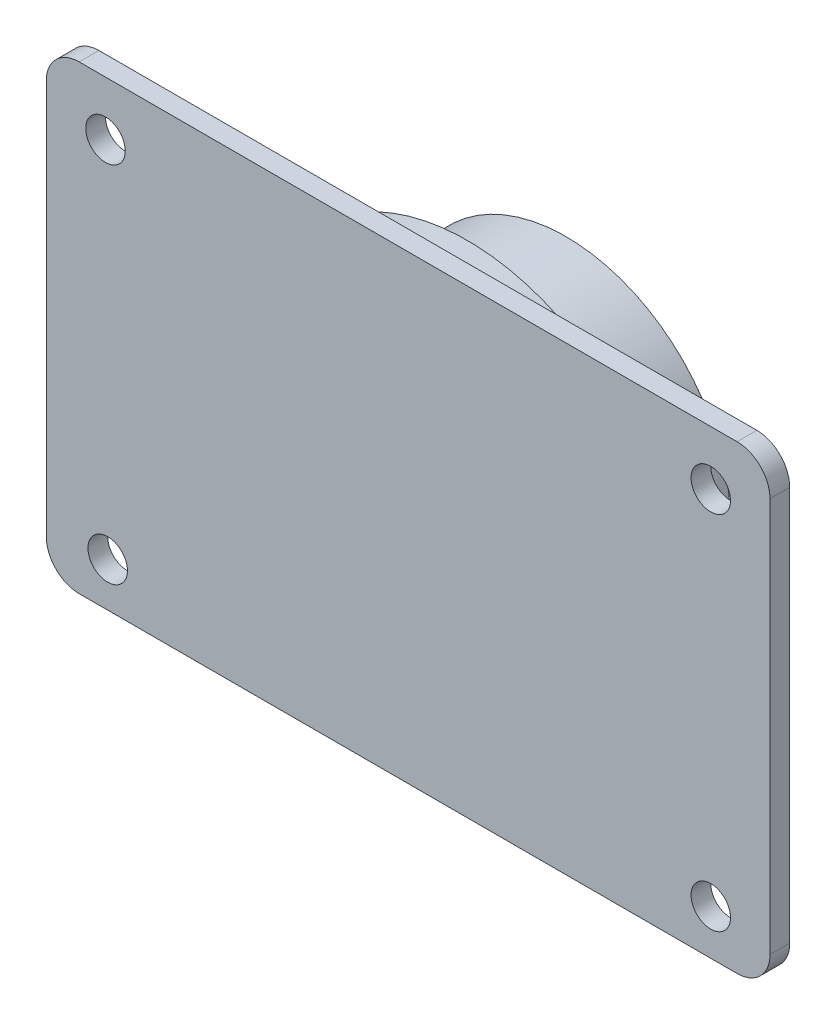
from build123d import *

# Parameters (mm, degrees)
SKETCH3_R             = 25
BOSS_EXTRUDE1_DEPTH   = 15
SKETCH4_R             = 32
BOSS_EXTRUDE2_DEPTH   = 6
BOSS_EXTRUDE3_DEPTH   = 3
FILLET1_R             = 5
FILLET2_R             = 5
SKETCH8_R             = 3
CUT_EXTRUDE1_DEPTH    = 3
BODY_MOVE_COPY1_ANGLE = 120


with BuildPart() as part:
    # Sketch3 → Boss-Extrude1 (new body)
    with BuildSketch(Plane(origin=(0, 0, 0), x_dir=(1, 0, 0), z_dir=(0, 1, 0))):
        Circle(SKETCH3_R)
    extrude(amount=-BOSS_EXTRUDE1_DEPTH)

    # Sketch4 → Boss-Extrude2 (add)
    with BuildSketch(Plane.XZ.offset(15)):
        Circle(SKETCH4_R)
    extrude(amount=BOSS_EXTRUDE2_DEPTH)

    # Sketch6 → Boss-Extrude3 (add)
    with BuildSketch(Plane.XZ.offset(21)):
        Polygon((35, 0), (35, -55), (-35, -55), (-35, 55), (35, 55), align=None)
    extrude(amount=BOSS_EXTRUDE3_DEPTH)

    # Fillet1
    fillet1_edges = [part.edges().sort_by_distance(p)[0] for p in [
        (35, -22.5, 55),
    ]]
    fillet(fillet1_edges, radius=FILLET1_R)

    # Fillet2
    fillet2_edges = [part.edges().sort_by_distance(p)[0] for p in [
        (-35, -22.5, 55),
        (-35, -22.5, -55),
        (35, -22.5, -55),
    ]]
    fillet(fillet2_edges, radius=FILLET2_R)

    # Sketch8 → Cut-Extrude1 (cut)
    with BuildSketch(Plane.XZ.offset(24)):
        with Locations((26.758523595, -46)):
            Circle(SKETCH8_R)
        with Locations((-28.158970904, -46)):
            Circle(SKETCH8_R)
        with Locations((26.758523595, 46)):
            Circle(SKETCH8_R)
        with Locations((-28.320886722, 45.663145403)):
            Circle(SKETCH8_R)
    extrude(amount=-CUT_EXTRUDE1_DEPTH, mode=Mode.SUBTRACT)


with BuildPart() as part_1:
    # Body-Move/Copy1: moved
    add(part.part.rotate(Axis((0, 0, 0), (-0.5773502691896252, -0.5773502691896272, 0.5773502691896252)), BODY_MOVE_COPY1_ANGLE))


with BuildPart() as part_2:
    # Body-Move/Copy2: moved
    add(part_1.part.moved(Location((0, 0, -24))))


solid = part_2.part
